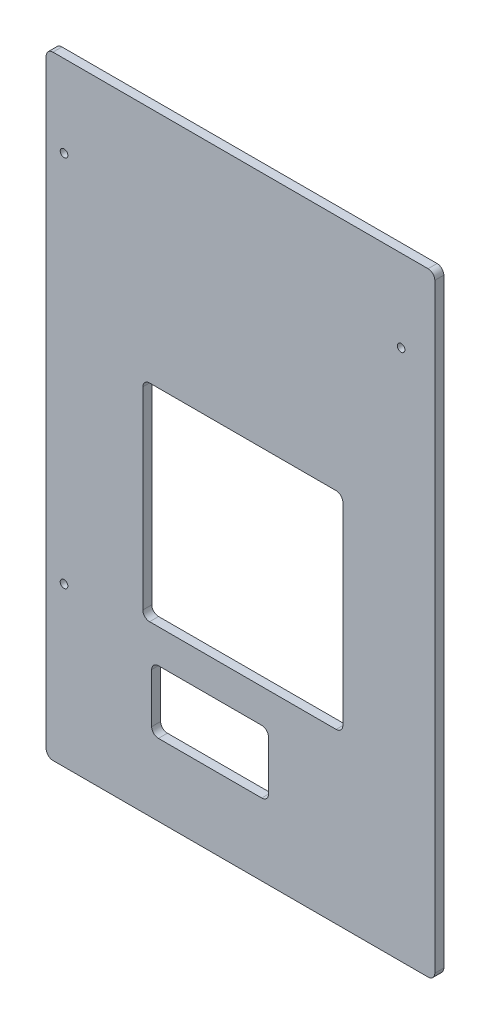
from build123d import *

# Parameters (mm, degrees)
ESQUISSE1_W        = 172.93
ESQUISSE1_H        = 273
ESQUISSE1_R        = 1.5
ESQUISSE1_W_2      = 89
ESQUISSE1_H_2      = 92
ESQUISSE1_W_3      = 52
ESQUISSE1_H_3      = 28
BOSS_EXTRU_1_DEPTH = 4
CONG_1_R           = 3
D_GAGEMENT_M31_D   = 3.4


with BuildPart() as part:
    # Esquisse1 → Boss.-Extru.1 (new body)
    with BuildSketch(Plane.XY):
        with Locations((86.465, 136.5)):
            Rectangle(ESQUISSE1_W, ESQUISSE1_H)
        with Locations((7.93, 236.5)):
            Circle(ESQUISSE1_R, mode=Mode.SUBTRACT)
        with Locations((7.93, 70.5)):
            Circle(ESQUISSE1_R, mode=Mode.SUBTRACT)
        with Locations((157.93, 236.5)):
            Circle(ESQUISSE1_R, mode=Mode.SUBTRACT)
        with Locations((87.5, 121)):
            Rectangle(ESQUISSE1_W_2, ESQUISSE1_H_2, mode=Mode.SUBTRACT)
        with Locations((72.93, 46)):
            Rectangle(ESQUISSE1_W_3, ESQUISSE1_H_3, mode=Mode.SUBTRACT)
    extrude(amount=BOSS_EXTRU_1_DEPTH)

    # Congé1
    cong_1_edges = [part.edges().sort_by_distance(p)[0] for p in [
        (0, 0, 2),
        (172.93, 0, 2),
        (172.93, 273, 2),
        (0, 273, 2),
        (43, 75, 2),
        (132, 75, 2),
        (132, 167, 2),
        (43, 167, 2),
        (98.93, 32, 2),
        (46.93, 32, 2),
        (98.93, 60, 2),
        (46.93, 60, 2),
    ]]
    fillet(cong_1_edges, radius=CONG_1_R)

    # Dégagement M31 (through all)
    with Locations(Plane.XY.offset(4)):
        with Locations((7.93, 236.5), (7.93, 70.5), (157.93, 236.5)):
            Hole(D_GAGEMENT_M31_D / 2)


solid = part.part
